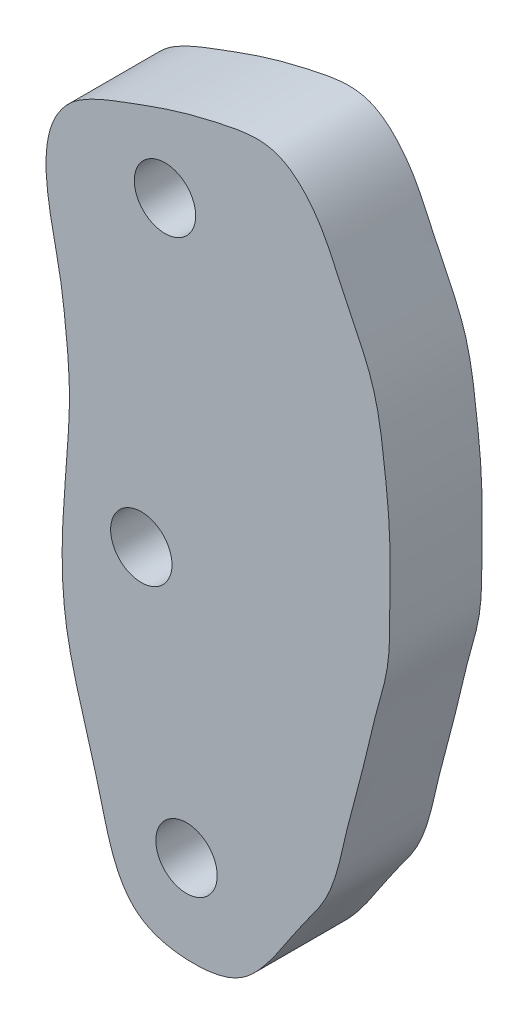
from build123d import *

# Parameters (mm, degrees)
BOSS_EXTRUDE1_DEPTH = 3
CUT_EXTRUDE1_REACH  = 34.801
SKETCH2_R           = 1


with BuildPart() as part:
    # Sketch1 → Boss-Extrude1 (new body)
    with BuildSketch(Plane.XY):
        with BuildLine():
            add(Edge.make_bspline(
                [(-11.283392565, 28.458981999), (-10.736916377, 28.663389934), (-9.675621723, 29.059257588), (-8.062807659, 29.457311045), (-6.343216293, 29.76766322), (-4.885439243, 28.429973806), (-4.166737884, 26.583466039), (-3.081063957, 24.629926423), (-2.805822718, 22.477739485), (-2.595023839, 20.572246851), (-2.652914599, 18.668046655), (-2.586359626, 16.935142885), (-3.166863845, 15.086136447), (-3.532993772, 13.326047689), (-4.124624655, 11.310596664), (-4.442334532, 9.469666963), (-5.623981232, 7.993924038), (-6.406027212, 6.683135384), (-7.50937329, 5.431033439), (-9.112837559, 5.17643767), (-11.447945387, 5.588176376), (-11.982174355, 8.313262433), (-12.681612883, 10.600356565), (-13.288977174, 12.832976142), (-13.356872926, 15.383816544), (-13.134368493, 17.585182386), (-13.038963934, 19.589909986), (-13.175841057, 20.99623973), (-13.397558591, 22.854244248), (-13.905944627, 24.633336312), (-13.836059607, 26.545327481), (-13.1020693, 27.586999959), (-12.269349218, 28.089757298), (-11.635330104, 28.327340718), (-11.283392565, 28.458981999)],
                knots=[0, 0, 0, 0, 0.029558469, 0.05703987, 0.085949524, 0.111532494, 0.148878451, 0.187113365, 0.223386191, 0.257681189, 0.284419852, 0.320102337, 0.344601522, 0.382071297, 0.411256374, 0.451665834, 0.474120691, 0.505641259, 0.530331102, 0.554660819, 0.5852848, 0.639530569, 0.673538156, 0.711102425, 0.755327722, 0.802267857, 0.823406789, 0.857005459, 0.873816676, 0.918175328, 0.951492311, 0.965564599, 0.980963974, 1, 1, 1, 1], degree=3))
        make_face()
    extrude(amount=BOSS_EXTRUDE1_DEPTH)

    # Sketch2 → Cut-Extrude1 (cut, up to next)
    with BuildSketch(Plane.XY.offset(3), mode=Mode.PRIVATE) as cut_extrude1_sk1:
        with Locations((-10.732075713, 16.17418923)):
            Circle(SKETCH2_R)
    cut_extrude1_tool1 = extrude(cut_extrude1_sk1.sketch, amount=-CUT_EXTRUDE1_REACH, mode=Mode.PRIVATE) & part.part
    # Sketch2 → Cut-Extrude1 (cut, up to next)
    with BuildSketch(Plane.XY.offset(3), mode=Mode.PRIVATE) as cut_extrude1_sk2:
        with Locations((-9.960061545, 26.413963068)):
            Circle(SKETCH2_R)
    cut_extrude1_tool2 = extrude(cut_extrude1_sk2.sketch, amount=-CUT_EXTRUDE1_REACH, mode=Mode.PRIVATE) & part.part
    # Sketch2 → Cut-Extrude1 (cut, up to next)
    with BuildSketch(Plane.XY.offset(3), mode=Mode.PRIVATE) as cut_extrude1_sk3:
        with Locations((-9.25852939, 8.132319796)):
            Circle(SKETCH2_R)
    cut_extrude1_tool3 = extrude(cut_extrude1_sk3.sketch, amount=-CUT_EXTRUDE1_REACH, mode=Mode.PRIVATE) & part.part
    add(cut_extrude1_tool1.solids().sort_by_distance((-10.732076, 16.174189, 3))[0], mode=Mode.SUBTRACT)
    add(cut_extrude1_tool2.solids().sort_by_distance((-9.960062, 26.413963, 3))[0], mode=Mode.SUBTRACT)
    add(cut_extrude1_tool3.solids().sort_by_distance((-9.258529, 8.13232, 3))[0], mode=Mode.SUBTRACT)


solid = part.part
